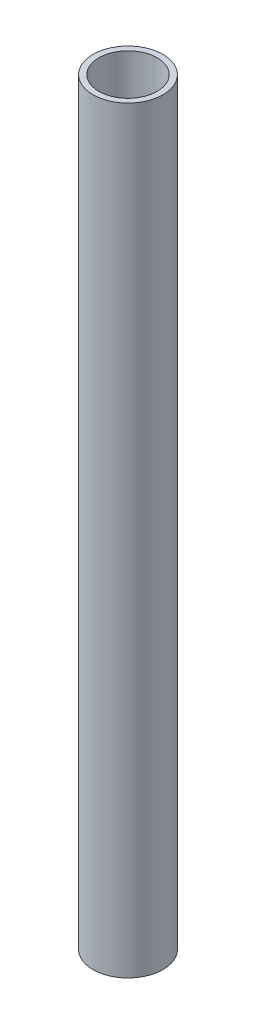
from build123d import *

# Parameters (mm, degrees)
SKETCH1_R               = 7.62
SKETCH1_R_2             = 6.35
BOSS_EXTRUDE1_DEPTH     = 165.1
CUT_EXTRUDE1_REACH      = 167.977
CUT_EXTRUDE1_END_RADIUS = 6.35
FILLET3_R               = 2.54


with BuildPart() as part:
    # Sketch1 → Boss-Extrude1 (new body)
    with BuildSketch(Plane(origin=(0, 0, 0), x_dir=(1, 0, 0), z_dir=(0, 1, 0))):
        with Locations(Location((0, 0, 0), (0, 0, 270))):
            Circle(SKETCH1_R)
        with Locations(Location((0, 0, 0), (0, 0, 270))):
            Circle(SKETCH1_R_2, mode=Mode.SUBTRACT)
    extrude(amount=BOSS_EXTRUDE1_DEPTH)

    # Cut-Extrude1: up to this cylinder (the profile starts outside it)
    cut_extrude1_end = Plane(origin=(0, 137.302889, 0), z_dir=(0, -1, 0)) * Cylinder(CUT_EXTRUDE1_END_RADIUS, 360.824706, mode=Mode.PRIVATE)
    # Sketch2 → Cut-Extrude1 (cut, up to the surface)
    with BuildSketch(Plane.ZY.offset(7.62), mode=Mode.PRIVATE) as cut_extrude1_sk1:
        with BuildLine():
            Line((-2.286, 154.058948498), (-2.286, 131.717535749))
            ThreePointArc((-2.286, 131.717535749), (-3.81, 130.193535749), (-5.334, 131.717535749))
            Line((-5.334, 131.717535749), (-5.334, 154.058948498))
            ThreePointArc((-5.334, 154.058948498), (-3.81, 155.582948498), (-2.286, 154.058948498))
        make_face()
    cut_extrude1_tool1 = extrude(cut_extrude1_sk1.sketch, amount=-CUT_EXTRUDE1_REACH, mode=Mode.PRIVATE) - cut_extrude1_end
    add(cut_extrude1_tool1.solids().sort_by_distance((-7.62, 142.888242, -3.81))[0], mode=Mode.SUBTRACT)
    # Sketch2 → Cut-Extrude1 (cut, up to the surface)
    with BuildSketch(Plane.ZY.offset(7.62), mode=Mode.PRIVATE) as cut_extrude1_sk2:
        with BuildLine():
            Line((2.286, 131.717535749), (2.286, 138.086901397))
            ThreePointArc((2.286, 138.086901397), (3.81, 139.610901397), (5.334, 138.086901397))
            Line((5.334, 138.086901397), (5.334, 131.717535749))
            ThreePointArc((5.334, 131.717535749), (3.81, 130.193535749), (2.286, 131.717535749))
        make_face()
    cut_extrude1_tool2 = extrude(cut_extrude1_sk2.sketch, amount=-CUT_EXTRUDE1_REACH, mode=Mode.PRIVATE) - cut_extrude1_end
    add(cut_extrude1_tool2.solids().sort_by_distance((-7.62, 134.902219, 3.81))[0], mode=Mode.SUBTRACT)
    # Sketch2 → Cut-Extrude1 (cut, up to the surface)
    with BuildSketch(Plane.ZY.offset(7.62), mode=Mode.PRIVATE) as cut_extrude1_sk3:
        with BuildLine():
            Line((-3.81, 133.241535749), (3.81, 133.241535749))
            ThreePointArc((3.81, 133.241535749), (5.334, 131.717535749), (3.81, 130.193535749))
            Line((3.81, 130.193535749), (-3.81, 130.193535749))
            ThreePointArc((-3.81, 130.193535749), (-5.334, 131.717535749), (-3.81, 133.241535749))
        make_face()
    cut_extrude1_tool3 = extrude(cut_extrude1_sk3.sketch, amount=-CUT_EXTRUDE1_REACH, mode=Mode.PRIVATE) - cut_extrude1_end
    add(cut_extrude1_tool3.solids().sort_by_distance((-7.62, 131.717536, 0))[0], mode=Mode.SUBTRACT)

    # Fillet3
    # the kernel refuses this fillet: 2.54 mm, written as the material it takes off along each edge
    with BuildSketch(Plane(origin=(-13.619016715, 133.241535749, 2.286), x_dir=(0, 0, -1), z_dir=(1, 0, 0)), Plane(origin=(0.425752875, 133.241535749, -2.286), x_dir=(0, 0, 1), z_dir=(-1, 0, 0))) as fillet3_piece_1:
        with BuildLine():
            CenterArc((FILLET3_R, FILLET3_R), FILLET3_R, 180, 90)
            Line((0, FILLET3_R), (0, 0))
            Line((0, 0), (FILLET3_R, 0))
        make_face()
    extrude(amount=14.04476959, mode=Mode.SUBTRACT)


solid = part.part
